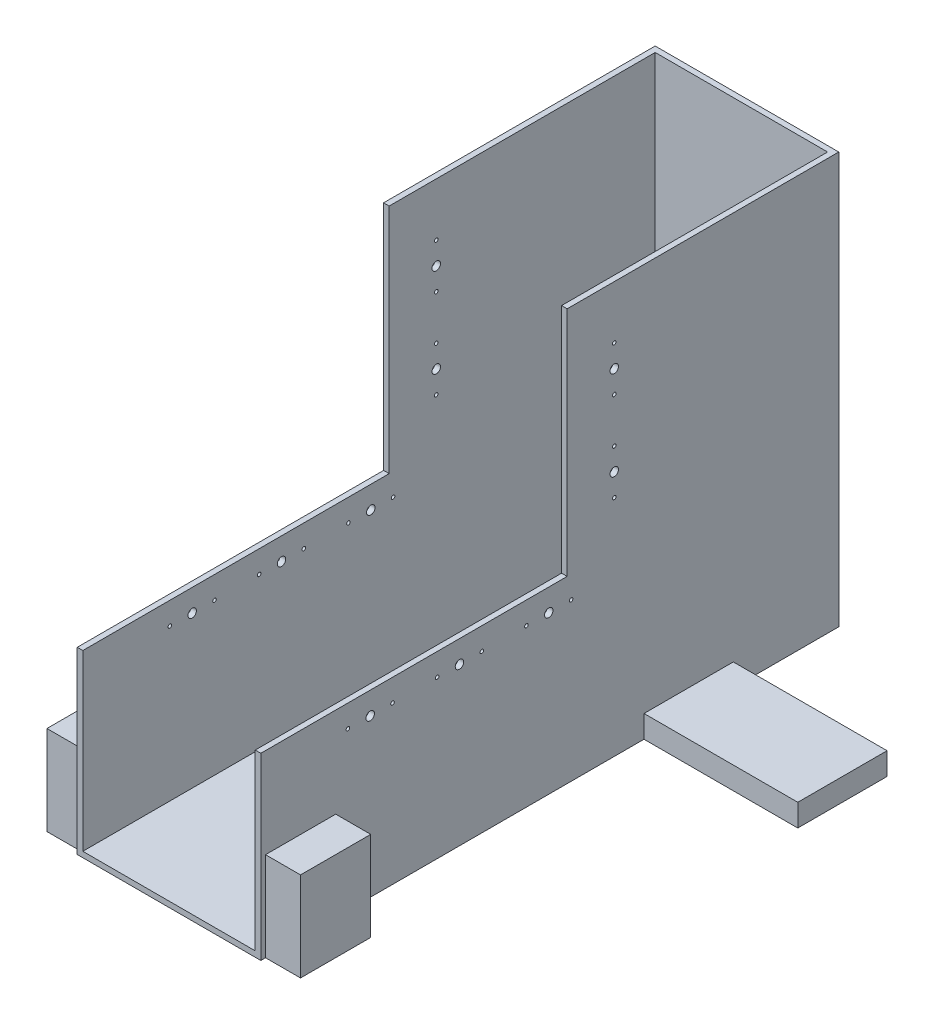
from build123d import *

# Parameters (mm, degrees)
BOSS_EXTRUDE1_DEPTH = 6.35
SKETCH17_W          = 196.1896
SKETCH17_H          = 657.6157706
BOSS_EXTRUDE2_DEPTH = 6.35
SKETCH18_W          = 208.8896
SKETCH18_H          = 467.912654328
BOSS_EXTRUDE3_DEPTH = 6.35
SKETCH20_W          = 174.9552
SKETCH20_H          = 101.6
BOSS_EXTRUDE4_DEPTH = 25.4
SKETCH22_W          = 39.8272
SKETCH22_H          = 79.88897833
BOSS_EXTRUDE5_DEPTH = 101.6
SKETCH25_R          = 4.826
CUT_EXTRUDE1_DEPTH  = 6.35
SKETCH27_R          = 2.032
SKETCH27_R_2        = 0.035171884
CUT_EXTRUDE2_DEPTH  = 10.16
SKETCH28_R          = 2.032
SKETCH28_R_2        = 0.035171884
CUT_EXTRUDE3_DEPTH  = 14.732
SKETCH29_R          = 2.032
CUT_EXTRUDE4_DEPTH  = 144.272
SKETCH30_R          = 2.032
CUT_EXTRUDE6_DEPTH  = 23.114
SKETCH30_6_R        = 2.032
CUT_EXTRUDE7_DEPTH  = 23.114


with BuildPart() as part:
    # Sketch15 → Boss-Extrude1 (new body)
    with BuildSketch(Plane(origin=(0, 0, 0), x_dir=(0, 0, -1), z_dir=(1, 0, 0))):
        Polygon((0, 0), (-657.6157706, 0), (-657.6157706, 204.204861602), (-309.033798252, 204.204861602), (-309.033798252, 467.912654328), (0, 467.912654328), align=None)
    boss_extrude1 = extrude(amount=-BOSS_EXTRUDE1_DEPTH)

    # Sketch17 → Boss-Extrude2 (add)
    with BuildSketch(Plane(origin=(0, 0, 0), x_dir=(1, 0, 0), z_dir=(0, 1, 0))):
        with Locations((98.0948, -328.8078853)):
            Rectangle(SKETCH17_W, SKETCH17_H)
    extrude(amount=BOSS_EXTRUDE2_DEPTH)

    # Mirror1: Boss-Extrude1 across plane
    add(boss_extrude1.mirror(Plane(origin=(98.0948, 0, 0), x_dir=(0, 0, 1), z_dir=(1, 0, 0))))

    # Sketch18 → Boss-Extrude3 (add)
    with BuildSketch(Plane(origin=(0, 0, 0), x_dir=(-1, 0, 0), z_dir=(0, 0, -1))):
        with Locations((-98.0948, 233.956327164)):
            Rectangle(SKETCH18_W, SKETCH18_H)
    extrude(amount=-BOSS_EXTRUDE3_DEPTH)

    # Sketch20 → Boss-Extrude4 (add)
    with BuildSketch(Plane(origin=(0, 0, 0), x_dir=(1, 0, 0), z_dir=(0, 1, 0))):
        with Locations((-93.8276, -170.785936787)):
            Rectangle(SKETCH20_W, SKETCH20_H)
        with Locations((290.0172, -170.785936787)):
            Rectangle(SKETCH20_W, SKETCH20_H)
    extrude(amount=BOSS_EXTRUDE4_DEPTH)

    # Sketch22 → Boss-Extrude5 (add)
    with BuildSketch(Plane(origin=(0, 0, 0), x_dir=(1, 0, 0), z_dir=(0, 1, 0))):
        with Locations((-26.2636, -612.31684817)):
            Rectangle(SKETCH22_W, SKETCH22_H)
        with Locations((222.4532, -612.31684817)):
            Rectangle(SKETCH22_W, SKETCH22_H)
    extrude(amount=BOSS_EXTRUDE5_DEPTH)

    # Sketch25 → Cut-Extrude1 (cut)
    with BuildSketch(Plane.ZY.offset(6.35)):
        with Locations((533.1557706, 178.804861602)):
            Circle(SKETCH25_R)
        with Locations((431.5557706, 178.804861602)):
            Circle(SKETCH25_R)
        with Locations((329.9557706, 178.804861602)):
            Circle(SKETCH25_R)
        with Locations((255.439798252, 280.460654328)):
            Circle(SKETCH25_R)
        with Locations((255.439798252, 382.060654328)):
            Circle(SKETCH25_R)
    cut_extrude1 = extrude(amount=-CUT_EXTRUDE1_DEPTH, mode=Mode.SUBTRACT)

    # Mirror2: Cut-Extrude1 across plane
    add(cut_extrude1.mirror(Plane(origin=(98.0948, 0, 0), x_dir=(0, 0, 1), z_dir=(1, 0, 0))), mode=Mode.SUBTRACT)

    # Sketch27 → Cut-Extrude2 (cut)
    with BuildSketch(Plane.ZY.offset(6.35)):
        with Locations((355.3557706, 178.804861602)):
            Circle(SKETCH27_R)
        with Locations((304.5557706, 178.804861602)):
            Circle(SKETCH27_R_2)
    cut_extrude2 = extrude(amount=-CUT_EXTRUDE2_DEPTH, mode=Mode.SUBTRACT)

    # Sketch28 → Cut-Extrude3 (cut)
    with BuildSketch(Plane.ZY.offset(6.35)):
        with Locations((304.5557706, 178.804861602)):
            Circle(SKETCH28_R)
        with Locations((304.5557706, 178.804861602)):
            Circle(SKETCH28_R_2, mode=Mode.SUBTRACT)
    cut_extrude3 = extrude(amount=-CUT_EXTRUDE3_DEPTH, mode=Mode.SUBTRACT)

    # Sketch29 → Cut-Extrude4 (cut)
    with BuildSketch(Plane(origin=(98.0948, 0, 0), x_dir=(0, 0, -1), z_dir=(1, 0, 0))):
        with Locations((-406.1557706, 178.804861602)):
            Circle(SKETCH29_R)
        with Locations((-456.9557706, 178.804861602)):
            Circle(SKETCH29_R)
        with Locations((-507.7557706, 178.804861602)):
            Circle(SKETCH29_R)
        with Locations((-558.5557706, 178.804861602)):
            Circle(SKETCH29_R)
    cut_extrude4 = extrude(amount=-CUT_EXTRUDE4_DEPTH, mode=Mode.SUBTRACT)

    # Mirror3: Cut-Extrude2, Cut-Extrude3, Cut-Extrude4 across plane
    add(cut_extrude2.mirror(Plane(origin=(98.0948, 0, 0), x_dir=(0, 0, 1), z_dir=(1, 0, 0))), mode=Mode.SUBTRACT)
    add(cut_extrude3.mirror(Plane(origin=(98.0948, 0, 0), x_dir=(0, 0, 1), z_dir=(1, 0, 0))), mode=Mode.SUBTRACT)
    add(cut_extrude4.mirror(Plane(origin=(98.0948, 0, 0), x_dir=(0, 0, 1), z_dir=(1, 0, 0))), mode=Mode.SUBTRACT)

    # Sketch30 → Cut-Extrude6 (cut)
    with BuildSketch(Plane.ZY.offset(6.35)):
        with Locations((255.439798252, 407.460654328)):
            Circle(SKETCH30_R)
    cut_extrude6 = extrude(amount=-CUT_EXTRUDE6_DEPTH, mode=Mode.SUBTRACT)

    # Sketch30<6> → Cut-Extrude7 (cut)
    with BuildSketch(Plane.ZY.offset(6.35)):
        with Locations((255.439798252, 356.660654328)):
            Circle(SKETCH30_6_R)
        with Locations((255.439798252, 305.860654328)):
            Circle(SKETCH30_6_R)
        with Locations((255.439798252, 255.060654328)):
            Circle(SKETCH30_6_R)
    cut_extrude7 = extrude(amount=-CUT_EXTRUDE7_DEPTH, mode=Mode.SUBTRACT)

    # Mirror4: Cut-Extrude6, Cut-Extrude7 across plane
    add(cut_extrude6.mirror(Plane(origin=(98.0948, 0, 0), x_dir=(0, 0, 1), z_dir=(1, 0, 0))), mode=Mode.SUBTRACT)
    add(cut_extrude7.mirror(Plane(origin=(98.0948, 0, 0), x_dir=(0, 0, 1), z_dir=(1, 0, 0))), mode=Mode.SUBTRACT)


solid = part.part
